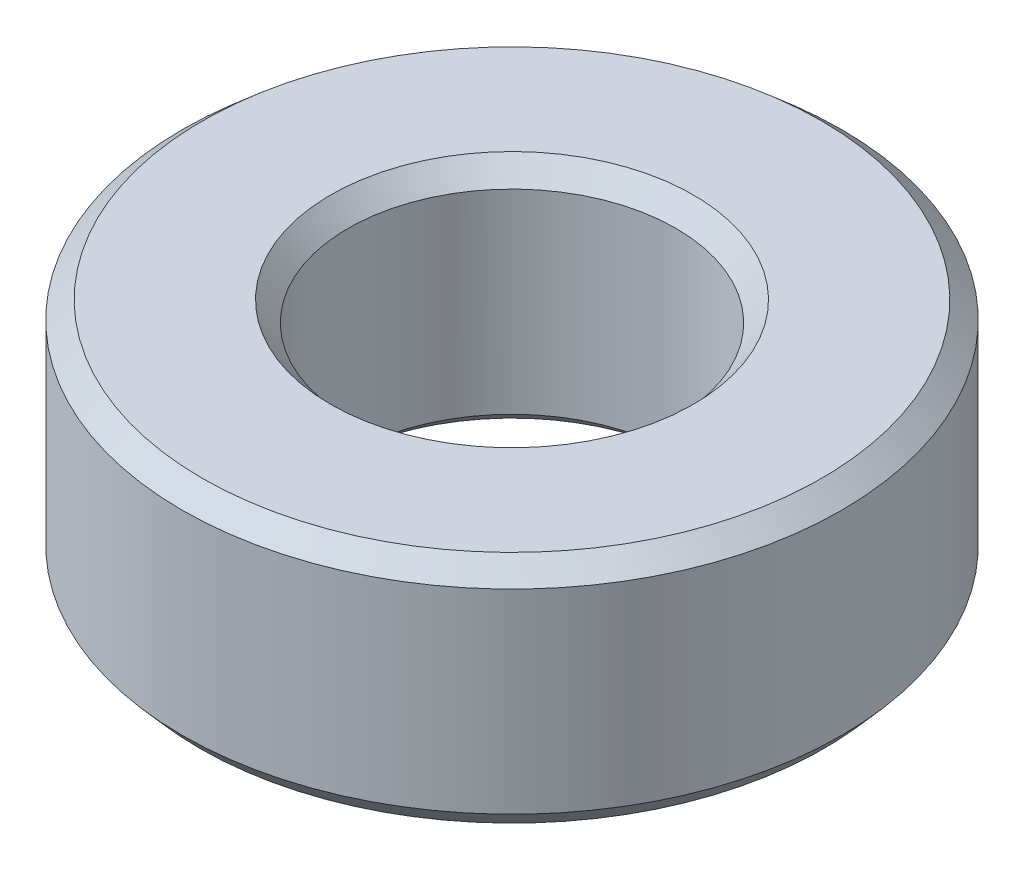
from build123d import *
from OCP.BRepFilletAPI import BRepFilletAPI_MakeChamfer

# Parameters (mm, degrees)
SKETCH1_R           = 27.5
BOSS_EXTRUDE1_DEPTH = 19.404706261
SKETCH2_R           = 13.666072631
CUT_EXTRUDE1_DEPTH  = 44.463117986
CHAMFER1_SIZE       = 1.463971843
CHAMFER1_SIZE2      = 1.67702674


with BuildPart() as part:
    # Sketch1 → Boss-Extrude1 (new body)
    with BuildSketch(Plane(origin=(0, 0, 0), x_dir=(1, 0, 0), z_dir=(0, 1, 0))):
        Circle(SKETCH1_R)
    extrude(amount=BOSS_EXTRUDE1_DEPTH)

    # Sketch2 → Cut-Extrude1 (cut, through all)
    with BuildSketch(Plane(origin=(0, 0, 0), x_dir=(1, 0, 0), z_dir=(0, 1, 0))):
        Circle(SKETCH2_R)
    extrude(amount=CUT_EXTRUDE1_DEPTH, mode=Mode.SUBTRACT)

    # Chamfer1: one chamfer whose edges measure the first distance from different faces: ONE call of the kernel's chamfer builder (chamfer() names one face for all edges)
    chamfer1_edges_1 = [part.edges().sort_by_distance(p)[0] for p in [
        (-13.666072631, 19.404706261, 0),
    ]]
    chamfer1_side_1 = [part.faces().sort_by_distance(p)[0] for p in [
        (-26.722182541, 19.404706261, 0),
    ]]
    chamfer1_edges_2 = [part.edges().sort_by_distance(p)[0] for p in [
        (-13.666072631, 0, 0),
    ]]
    chamfer1_side_2 = [part.faces().sort_by_distance(p)[0] for p in [
        (-13.666072631, 9.70235313, 0),
    ]]
    chamfer1_edges_3 = [part.edges().sort_by_distance(p)[0] for p in [
        (-27.5, 0, 0),
    ]]
    chamfer1_side_3 = [part.faces().sort_by_distance(p)[0] for p in [
        (-26.722182541, 0, 0),
    ]]
    chamfer1_edges_4 = [part.edges().sort_by_distance(p)[0] for p in [
        (-27.5, 19.404706261, 0),
    ]]
    chamfer1_side_4 = [part.faces().sort_by_distance(p)[0] for p in [
        (-27.5, 9.70235313, 0),
    ]]
    chamfer1 = BRepFilletAPI_MakeChamfer(part.part.solid().wrapped)
    for e in chamfer1_edges_1:
        chamfer1.Add(CHAMFER1_SIZE, CHAMFER1_SIZE2, e.wrapped, chamfer1_side_1[0].wrapped)  # the first distance lies on this face
    for e in chamfer1_edges_2:
        chamfer1.Add(CHAMFER1_SIZE, CHAMFER1_SIZE2, e.wrapped, chamfer1_side_2[0].wrapped)  # the first distance lies on this face
    for e in chamfer1_edges_3:
        chamfer1.Add(CHAMFER1_SIZE, CHAMFER1_SIZE2, e.wrapped, chamfer1_side_3[0].wrapped)  # the first distance lies on this face
    for e in chamfer1_edges_4:
        chamfer1.Add(CHAMFER1_SIZE, CHAMFER1_SIZE2, e.wrapped, chamfer1_side_4[0].wrapped)  # the first distance lies on this face
    add(Compound.cast(chamfer1.Shape()), mode=Mode.REPLACE)


solid = part.part
